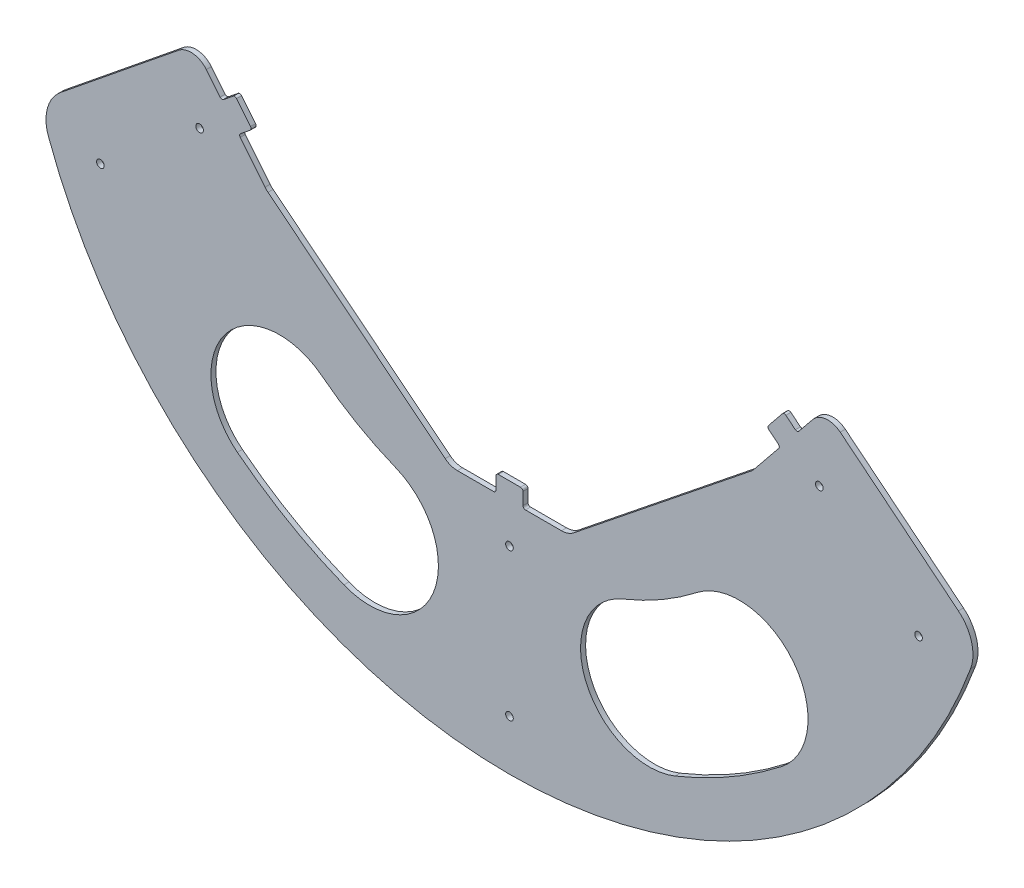
from build123d import *

# Parameters (mm, degrees)
BASE_FLANGE1_DEPTH           = 3.2639
F_10_0_1935_DIAMETER_HOLE1_D = 4.9149
FILLET1_R                    = 1.5875
FILLET2_R                    = 12.7
FILLET3_R                    = 25.4


# Sheet-metal steps are written as plain solids
with BuildPart() as part:
    # Sketch1 → Base-Flange1 (new body)
    with BuildSketch(Plane.XY):
        with BuildLine():
            Line((-175.064802987, -46.731119967), (-166.42876849, -39.737797122))
            Line((-166.42876849, -39.737797122), (-177.418275819, -26.16688577))
            Line((-177.418275819, -26.16688577), (-186.054310315, -33.160208616))
            Line((-186.054310315, -33.160208616), (-203.965209169, -11.04209055))
            Line((-203.965209169, -11.04209055), (-303.890728914, -91.960180949))
            ThreePointArc((-303.890728914, -91.960180949), (0, -317.5), (303.890728914, -91.960180949))
            Line((303.890728914, -91.960180949), (203.965209169, -11.04209055))
            Line((203.965209169, -11.04209055), (186.054310315, -33.160208616))
            Line((186.054310315, -33.160208616), (177.418275819, -26.16688577))
            Line((177.418275819, -26.16688577), (166.42876849, -39.737797122))
            Line((166.42876849, -39.737797122), (175.064802987, -46.731119967))
            Line((175.064802987, -46.731119967), (157.153904133, -68.849238033))
            Line((157.153904133, -68.849238033), (38.1, -164.30625))
            Line((38.1, -164.30625), (8.73125, -164.30625))
            Line((8.73125, -164.30625), (8.73125, -153.19375))
            Line((8.73125, -153.19375), (-8.73125, -153.19375))
            Line((-8.73125, -153.19375), (-8.73125, -164.30625))
            Line((-8.73125, -164.30625), (-38.1, -164.30625))
            Line((-38.1, -164.30625), (-157.153904133, -68.849238033))
            Line((-157.153904133, -68.849238033), (-175.064802987, -46.731119967))
        make_face()
        with BuildLine():
            ThreePointArc((-175.925266574, -225.174072843), (-142.875, -247.466759131), (-107.043834069, -264.942786442))
            ThreePointArc((-107.043834069, -264.942786442), (-49.179248656, -240.380727184), (-73.741307914, -182.516141771))
            ThreePointArc((-73.741307914, -182.516141771), (-98.425, -170.477100735), (-121.192961418, -155.119916847))
            ThreePointArc((-121.192961418, -155.119916847), (-183.586191994, -162.780842267), (-175.925266574, -225.174072843))
        make_face(mode=Mode.SUBTRACT)
        with BuildLine():
            ThreePointArc((175.925266574, -225.174072843), (142.875, -247.466759131), (107.043834069, -264.942786442))
            ThreePointArc((107.043834069, -264.942786442), (49.179248656, -240.380727184), (73.741307914, -182.516141771))
            ThreePointArc((73.741307914, -182.516141771), (98.425, -170.477100735), (121.192961418, -155.119916847))
            ThreePointArc((121.192961418, -155.119916847), (183.586191994, -162.780842267), (175.925266574, -225.174072843))
        make_face(mode=Mode.SUBTRACT)
    extrude(amount=-BASE_FLANGE1_DEPTH)

    # #10 (0.1935) Diameter Hole1 (through all)
    with Locations(Plane.XY):
        with Locations((-200.299064072, -55.930402224), (-264.45246319, -107.880800505), (0, -189.70625), (0, -284.95625), (200.299064072, -55.930402224), (264.45246319, -107.880800505)):
            Hole(F_10_0_1935_DIAMETER_HOLE1_D / 2)

    # Fillet1
    fillet1_edges = [part.edges().sort_by_distance(p)[0] for p in [
        (-8.73125, -164.30625, -1.63195),
        (-8.73125, -153.19375, -1.63195),
        (8.73125, -153.19375, -1.63195),
        (8.73125, -164.30625, -1.63195),
        (175.064802987, -46.731119967, -1.63195),
        (166.42876849, -39.737797122, -1.63195),
        (177.418275819, -26.16688577, -1.63195),
        (186.054310315, -33.160208616, -1.63195),
        (-186.054310315, -33.160208616, -1.63195),
        (-177.418275819, -26.16688577, -1.63195),
        (-166.42876849, -39.737797122, -1.63195),
        (-175.064802987, -46.731119967, -1.63195),
    ]]
    fillet(fillet1_edges, radius=FILLET1_R)

    # Fillet2
    fillet2_edges = [part.edges().sort_by_distance(p)[0] for p in [
        (-38.1, -164.30625, -1.63195),
        (38.1, -164.30625, -1.63195),
        (157.153904133, -68.849238033, -1.63195),
        (203.965209169, -11.04209055, -1.63195),
        (-203.965209169, -11.04209055, -1.63195),
        (-157.153904133, -68.849238033, -1.63195),
    ]]
    fillet(fillet2_edges, radius=FILLET2_R)

    # Fillet3
    fillet3_edges = [part.edges().sort_by_distance(p)[0] for p in [
        (303.890728914, -91.960180949, -1.63195),
        (-303.890728914, -91.960180949, -1.63195),
    ]]
    fillet(fillet3_edges, radius=FILLET3_R)


solid = part.part
